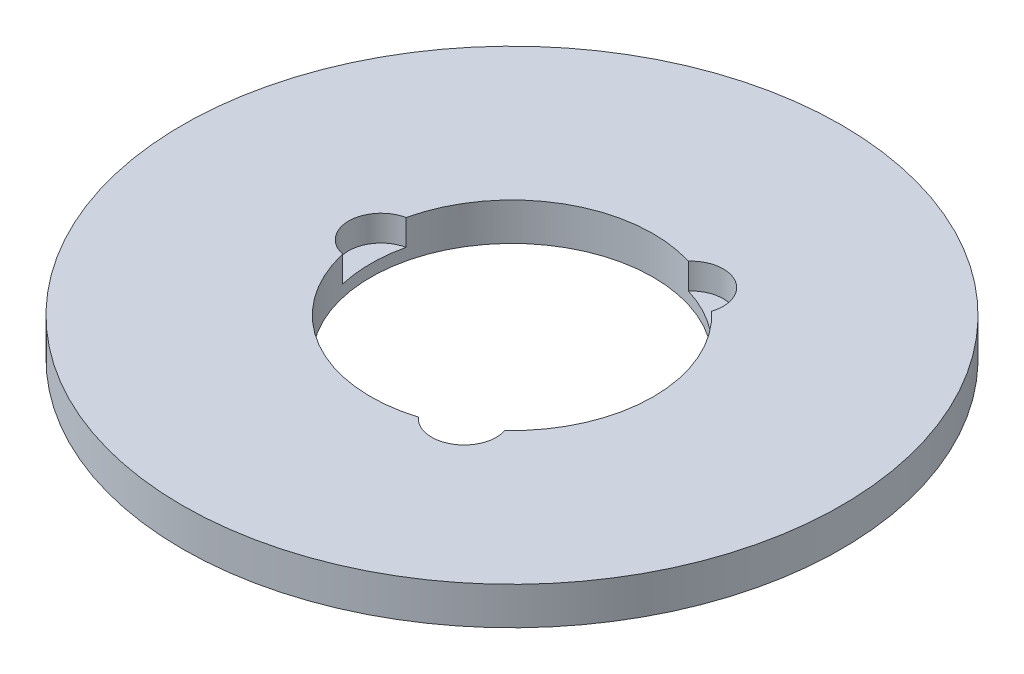
from build123d import *

# Parameters (mm, degrees)
SKETCH1_R           = 70
BOSS_EXTRUDE1_DEPTH = 8
SKETCH2_R           = 30
CUT_EXTRUDE1_DEPTH  = 100.317672143
SKETCH3_R           = 6.888520525
CUT_EXTRUDE2_DEPTH  = 5.490022236
CIRPATTERN1_COUNT   = 3


with BuildPart() as part:
    # Sketch1 → Boss-Extrude1 (new body)
    with BuildSketch(Plane(origin=(0, 0, 0), x_dir=(1, 0, 0), z_dir=(0, 1, 0))):
        Circle(SKETCH1_R)
    extrude(amount=BOSS_EXTRUDE1_DEPTH)

    # Sketch2 → Cut-Extrude1 (cut, through all)
    with BuildSketch(Plane(origin=(0, 0, 0), x_dir=(1, 0, 0), z_dir=(0, 1, 0))):
        Circle(SKETCH2_R)
    extrude(amount=CUT_EXTRUDE1_DEPTH, mode=Mode.SUBTRACT)

    # Sketch3 → Cut-Extrude2 (cut)
    with BuildSketch(Plane(origin=(0, 8, 0), x_dir=(1, 0, 0), z_dir=(0, 1, 0))):
        with Locations((-27.809030926, 0)):
            Circle(SKETCH3_R)
    cut_extrude2 = extrude(amount=-CUT_EXTRUDE2_DEPTH, mode=Mode.SUBTRACT)

    # CirPattern1: Cut-Extrude2 ×3 about axis
    cirpattern1_axis = Axis((0, 0, 0), (0, 1, 0))
    for i in range(1, CIRPATTERN1_COUNT):
        add(cut_extrude2.rotate(cirpattern1_axis, i * 360 / CIRPATTERN1_COUNT), mode=Mode.SUBTRACT)


solid = part.part
